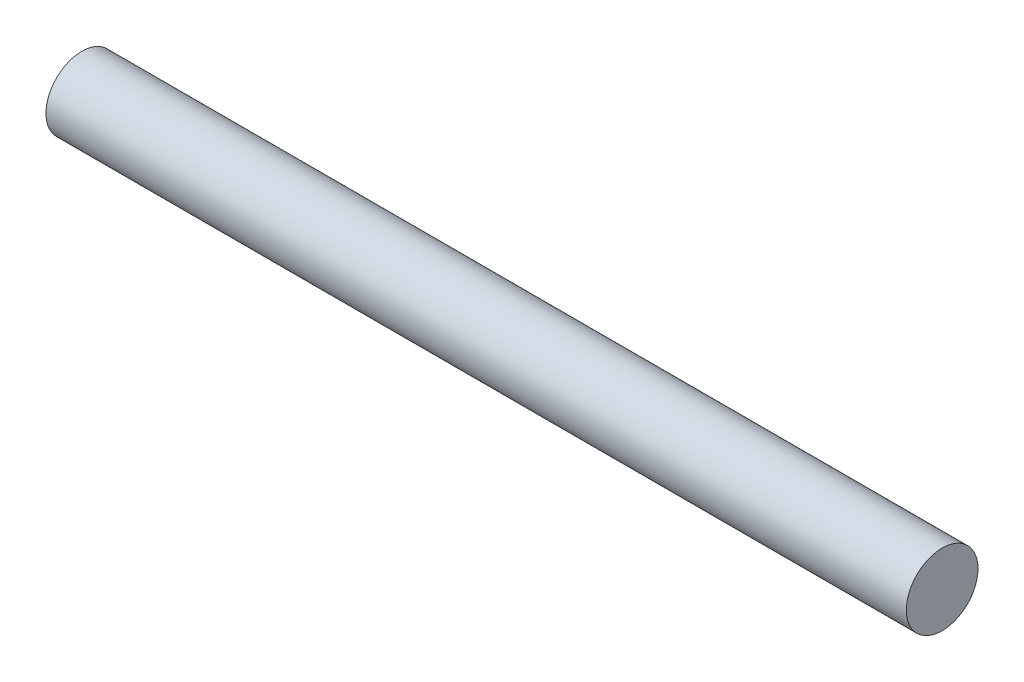
from build123d import *

# Parameters (mm, degrees)
BOSS_EXTRUDE1_DEPTH      = 30
BOSS_EXTRUDE1_DEPTH_BACK = 30
SKETCH1_R                = 2.5


with BuildPart() as part:
    # Sketch1 → Boss-Extrude1 (new, two sides: drawn at the far end of the back side and taken through both)
    with BuildSketch(Plane(origin=(0, 0, 0), x_dir=(0, 0, -1), z_dir=(1, 0, 0)).offset(-BOSS_EXTRUDE1_DEPTH_BACK)):
        Circle(SKETCH1_R)
    extrude(amount=BOSS_EXTRUDE1_DEPTH + BOSS_EXTRUDE1_DEPTH_BACK)


solid = part.part
